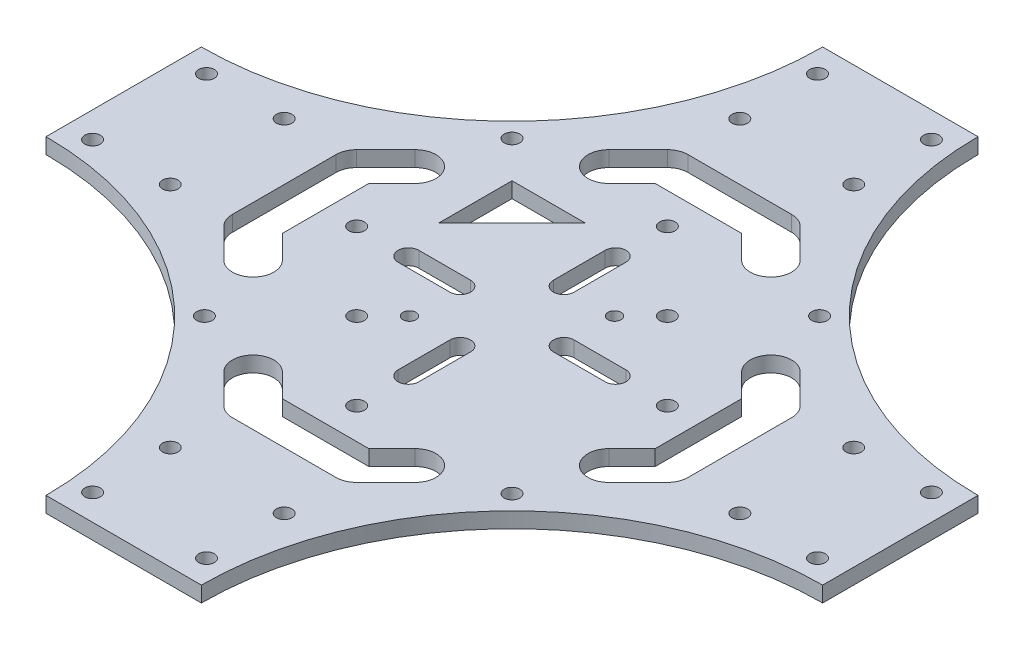
from build123d import *

# Parameters (mm, degrees)
SKETCH_1_R               = 1.25
EXTRUDE_1_DEPTH          = 3
SKETCH_2_R               = 1.5
CUT_EXTRUDE_1_DEPTH      = 3
CUT_EXTRUDE_2_DEPTH      = 3
CUT_EXTRUDE_3_DEPTH      = 3
CUT_EXTRUDE_4_DEPTH      = 10
SKETCH_6_R               = 1.5
CUT_EXTRUDE_5_DEPTH      = 10
SKETCH_7_R               = 1.5
CUT_EXTRUDE_8_DEPTH      = 10
SKETCH_8_R               = 1.5
CUT_EXTRUDE_9_DEPTH      = 10
SKETCH_9_R               = 15
CUT_EXTRUDE_10_DEPTH     = 10
SKETCH_11_R              = 1.5
EXTRUDE_3_DEPTH          = 3
CUT_EXTRUDE_12_DEPTH     = 3
EXTRUDE_4_DEPTH          = 3
SKETCH_15_R              = 15
EXTRUDE_5_DEPTH          = 3
CUT_EXTRUDE_13_DEPTH     = 3
EXTRUDE_START            = -3
EXTRUDE_7_DEPTH          = 3
CUT_EXTRUDE_14_DEPTH     = 3
CUT_EXTRUDE_15_DEPTH     = 3
PATTERN_CIRCULAR_1_COUNT = 8
SKETCH_22_R              = 1.25
CUT_EXTRUDE_17_DEPTH     = 3
SKETCH_23_R              = 1.5
CUT_EXTRUDE_18_DEPTH     = 10
SKETCH_24_R              = 1.5
CUT_EXTRUDE_19_DEPTH     = 10
CUT_EXTRUDE_START        = -10
SKETCH_25_R              = 60
CUT_EXTRUDE_20_DEPTH     = 10
EXTRUDE_8_DEPTH          = 3
EXTRUDE_10_DEPTH         = 3
SKETCH_28_R              = 1.54
SKETCH_28_R_2            = 1.52
SKETCH_28_R_3            = 1.5
CUT_EXTRUDE_21_DEPTH     = 3
SKETCH_29_R              = 1.5
CUT_EXTRUDE_22_DEPTH     = 3
EXTRUDE_11_DEPTH         = 3
SKETCH_31_R              = 1.5
CUT_EXTRUDE_23_DEPTH     = 3
EXTRUDE_12_DEPTH         = 3
CUT_EXTRUDE_24_DEPTH     = 3
EXTRUDE_13_DEPTH         = 3
CUT_EXTRUDE_25_DEPTH     = 10
CUT_EXTRUDE_26_DEPTH     = 10
EXTRUDE_14_DEPTH         = 3
SKETCH_38_R              = 6
CUT_EXTRUDE_28_DEPTH     = 3
SKETCH_39_R              = 1.5
CUT_EXTRUDE_29_DEPTH     = 3
SKETCH_40_R              = 60
CUT_EXTRUDE_30_DEPTH     = 10


with BuildPart() as part:
    # 草图1 → 凸台-拉伸1 (new body)
    with BuildSketch(Plane(origin=(0, 0, 0), x_dir=(1, 0, 0), z_dir=(0, 1, 0))):
        with BuildLine():
            Line((-75, 15), (-75, -15))
            ThreePointArc((-75, -15), (-32.573593129, -32.573593129), (-15, -75))
            Line((-15, -75), (15, -75))
            ThreePointArc((15, -75), (32.573593129, -32.573593129), (75, -15))
            Line((75, -15), (75, 15))
            ThreePointArc((75, 15), (32.573593129, 32.573593129), (15, 75))
            Line((15, 75), (-15, 75))
            ThreePointArc((-15, 75), (-32.573593129, 32.573593129), (-75, 15))
        make_face()
        with Locations((-70, 11)):
            Circle(SKETCH_1_R, mode=Mode.SUBTRACT)
        with Locations((-11, 70)):
            Circle(SKETCH_1_R, mode=Mode.SUBTRACT)
        with Locations((-70, -11)):
            Circle(SKETCH_1_R, mode=Mode.SUBTRACT)
        with Locations((-11, -70)):
            Circle(SKETCH_1_R, mode=Mode.SUBTRACT)
        with Locations((11, 70)):
            Circle(SKETCH_1_R, mode=Mode.SUBTRACT)
        with Locations((70, 11)):
            Circle(SKETCH_1_R, mode=Mode.SUBTRACT)
        with Locations((70, -11)):
            Circle(SKETCH_1_R, mode=Mode.SUBTRACT)
        with Locations((11, -70)):
            Circle(SKETCH_1_R, mode=Mode.SUBTRACT)
    extrude(amount=EXTRUDE_1_DEPTH)

    # 草图2 → 切除-拉伸1 (cut)
    with BuildSketch(Plane.XZ):
        with Locations((0.353553391, -31.466251763)):
            Circle(SKETCH_2_R)
        with Locations((31.466251763, -0.353553391)):
            Circle(SKETCH_2_R)
        with Locations((-0.353553391, 31.466251763)):
            Circle(SKETCH_2_R)
        with Locations((-31.466251763, 0.353553391)):
            Circle(SKETCH_2_R)
    extrude(amount=-CUT_EXTRUDE_1_DEPTH, mode=Mode.SUBTRACT)

    # 草图3 → 切除-拉伸2 (cut)
    with BuildSketch(Plane(origin=(0, 3, 0), x_dir=(1, 0, 0), z_dir=(0, 1, 0))):
        Polygon((-12.02081528, 19.091883092), (-22.627416998, 22.627416998), (-19.091883092, 12.02081528), align=None)
    extrude(amount=-CUT_EXTRUDE_2_DEPTH, mode=Mode.SUBTRACT)

    # 草图4 → 切除-拉伸3 (cut)
    with BuildSketch(Plane(origin=(0, 3, 0), x_dir=(1, 0, 0), z_dir=(0, 1, 0))):
        with BuildLine():
            ThreePointArc((33.944668714, -19.80253309), (34.043922781, -8.582763971), (22.827665534, -8.285032838))
            Line((22.827665534, -8.285032838), (15.556349186, -15.556349186))
            Line((15.556349186, -15.556349186), (8.285032838, -22.827665534))
            ThreePointArc((8.285032838, -22.827665534), (8.582763971, -34.043922781), (19.80253309, -33.944668714))
            Line((19.80253309, -33.944668714), (33.944668714, -19.80253309))
        make_face()
    extrude(amount=-CUT_EXTRUDE_3_DEPTH, mode=Mode.SUBTRACT)

    # 草图5 → 切除-拉伸4 (cut)
    with BuildSketch(Plane(origin=(0, 3, 0), x_dir=(1, 0, 0), z_dir=(0, 1, 0))):
        Polygon((-22.627416998, 22.627416998), (-12.02081528, 19.091883092), (-8.485281374, 22.627416998), align=None)
        Polygon((-19.091883092, 12.02081528), (-22.627416998, 22.627416998), (-22.627416998, 8.485281374), align=None)
    extrude(amount=-CUT_EXTRUDE_4_DEPTH, mode=Mode.SUBTRACT)

    # 草图6 → 切除-拉伸5 (cut)
    with BuildSketch(Plane(origin=(0, 3, 0), x_dir=(1, 0, 0), z_dir=(0, 1, 0))):
        with Locations((-35.355339059, -21.213203436)):
            Circle(SKETCH_6_R)
        with Locations((-21.213203436, -35.355339059)):
            Circle(SKETCH_6_R)
        with Locations((35.355339059, 21.213203436)):
            Circle(SKETCH_6_R)
        with Locations((21.213203436, 35.355339059)):
            Circle(SKETCH_6_R)
    extrude(amount=-CUT_EXTRUDE_5_DEPTH, mode=Mode.SUBTRACT)

    # 草图7 → 切除-拉伸8 (cut)
    with BuildSketch(Plane(origin=(0, 3, 0), x_dir=(1, 0, 0), z_dir=(0, 1, 0))):
        with Locations((-29.69848481, 29.69848481)):
            Circle(SKETCH_7_R)
        with Locations((29.69848481, 29.69848481)):
            Circle(SKETCH_7_R)
        with Locations((29.69848481, -29.69848481)):
            Circle(SKETCH_7_R)
        with Locations((-29.69848481, -29.69848481)):
            Circle(SKETCH_7_R)
    extrude(amount=-CUT_EXTRUDE_8_DEPTH, mode=Mode.SUBTRACT)

    # 草图8 → 切除-拉伸9 (cut)
    with BuildSketch(Plane(origin=(0, 3, 0), x_dir=(1, 0, 0), z_dir=(0, 1, 0))):
        with Locations((-11, 55)):
            Circle(SKETCH_8_R)
        with Locations((11, 55)):
            Circle(SKETCH_8_R)
        with Locations((55, 11)):
            Circle(SKETCH_8_R)
        with Locations((55, -11)):
            Circle(SKETCH_8_R)
        with Locations((11, -55)):
            Circle(SKETCH_8_R)
        with Locations((-11, -55)):
            Circle(SKETCH_8_R)
        with Locations((-55, -11)):
            Circle(SKETCH_8_R)
        with Locations((-55, 11)):
            Circle(SKETCH_8_R)
    extrude(amount=-CUT_EXTRUDE_9_DEPTH, mode=Mode.SUBTRACT)

    # 草图9 → 切除-拉伸10 (cut)
    with BuildSketch(Plane(origin=(0, 3, 0), x_dir=(1, 0, 0), z_dir=(0, 1, 0))):
        Circle(SKETCH_9_R)
    extrude(amount=-CUT_EXTRUDE_10_DEPTH, mode=Mode.SUBTRACT)

    # 草图11 → 凸台-拉伸3 (add)
    with BuildSketch(Plane(origin=(0, 3, 0), x_dir=(1, 0, 0), z_dir=(0, 1, 0))):
        with Locations((-35.355339059, -21.213203436)):
            Circle(SKETCH_11_R)
        with Locations((35.355339059, 21.213203436)):
            Circle(SKETCH_11_R)
        with Locations((21.213203436, 35.355339059)):
            Circle(SKETCH_11_R)
        with Locations((0.353553391, 31.466251763)):
            Circle(SKETCH_11_R)
        with Locations((31.466251763, 0.353553391)):
            Circle(SKETCH_11_R)
        with Locations((-0.353553391, -31.466251763)):
            Circle(SKETCH_11_R)
        with Locations((-31.466251763, -0.353553391)):
            Circle(SKETCH_11_R)
        with Locations((-21.213203436, -35.355339059)):
            Circle(SKETCH_11_R)
    extrude(amount=-EXTRUDE_3_DEPTH)

    # 草图12 → 切除-拉伸12 (cut)
    with BuildSketch(Plane(origin=(0, 3, 0), x_dir=(1, 0, 0), z_dir=(0, 1, 0))):
        with BuildLine():
            Line((-44, 10), (-44, -10))
            ThreePointArc((-44, -10), (-40, -14), (-36, -10))
            Line((-36, -10), (-36, 0))
            Line((-36, 0), (-36, 10))
            ThreePointArc((-36, 10), (-40, 14), (-44, 10))
        make_face()
        with BuildLine():
            Line((10, 44), (-10, 44))
            ThreePointArc((-10, 44), (-14, 40), (-10, 36))
            Line((-10, 36), (10, 36))
            ThreePointArc((10, 36), (14, 40), (10, 44))
        make_face()
        with BuildLine():
            Line((44, -10), (44, 10))
            ThreePointArc((44, 10), (40, 14), (36, 10))
            Line((36, 10), (36, -10))
            ThreePointArc((36, -10), (40, -14), (44, -10))
        make_face()
        with BuildLine():
            Line((-10, -44), (10, -44))
            ThreePointArc((10, -44), (14, -40), (10, -36))
            Line((10, -36), (-10, -36))
            ThreePointArc((-10, -36), (-14, -40), (-10, -44))
        make_face()
    extrude(amount=-CUT_EXTRUDE_12_DEPTH, mode=Mode.SUBTRACT)

    # 草图14 → 凸台-拉伸4 (add)
    with BuildSketch(Plane(origin=(0, 3, 0), x_dir=(1, 0, 0), z_dir=(0, 1, 0))):
        with BuildLine():
            ThreePointArc((8.285032838, -22.827665534), (8.582763971, -34.043922781), (19.80253309, -33.944668714))
            Line((19.80253309, -33.944668714), (33.944668714, -19.80253309))
            ThreePointArc((33.944668714, -19.80253309), (34.043922781, -8.582763971), (22.827665534, -8.285032838))
            Line((22.827665534, -8.285032838), (8.285032838, -22.827665534))
        make_face()
    extrude(amount=-EXTRUDE_4_DEPTH)

    # 草图15 → 凸台-拉伸5 (add)
    with BuildSketch(Plane(origin=(0, 3, 0), x_dir=(1, 0, 0), z_dir=(0, 1, 0))):
        Circle(SKETCH_15_R)
    extrude(amount=-EXTRUDE_5_DEPTH)

    # 草图17 → 切除-拉伸13 (cut)
    with BuildSketch(Plane(origin=(0, 3, 0), x_dir=(1, 0, 0), z_dir=(0, 1, 0))):
        with BuildLine():
            Line((-2, -20), (-2, -10))
            ThreePointArc((-2, -10), (0, -8), (2, -10))
            Line((2, -10), (2, -20))
            ThreePointArc((2, -20), (0, -22), (-2, -20))
        make_face()
        with BuildLine():
            Line((-20, 2), (-10, 2))
            ThreePointArc((-10, 2), (-8, 0), (-10, -2))
            Line((-10, -2), (-20, -2))
            ThreePointArc((-20, -2), (-22, 0), (-20, 2))
        make_face()
        with BuildLine():
            Line((2, 20), (2, 10))
            ThreePointArc((2, 10), (0, 8), (-2, 10))
            Line((-2, 10), (-2, 20))
            ThreePointArc((-2, 20), (0, 22), (2, 20))
        make_face()
        with BuildLine():
            Line((20, -2), (10, -2))
            ThreePointArc((10, -2), (8, 0), (10, 2))
            Line((10, 2), (20, 2))
            ThreePointArc((20, 2), (22, 0), (20, -2))
        make_face()
    extrude(amount=-CUT_EXTRUDE_13_DEPTH, mode=Mode.SUBTRACT)

    # 草图18 → 凸台-拉伸7 (add)
    with BuildSketch(Plane(origin=(0, 3, 0), x_dir=(1, 0, 0), z_dir=(0, 1, 0)).offset(EXTRUDE_START)):
        with BuildLine():
            ThreePointArc((-45.952273324, 22.500194525), (-32.573593129, 32.573593129), (-22.500194525, 45.952273324))
            Line((-22.500194525, 45.952273324), (-38.525223259, 61.977302058))
            ThreePointArc((-38.525223259, 61.977302058), (-89.142135624, 89.142135624), (-61.977302058, 38.525223259))
            Line((-61.977302058, 38.525223259), (-45.952273324, 22.500194525))
        make_face()
    extrude(amount=EXTRUDE_7_DEPTH)

    # 草图19 → 切除-拉伸14 (cut)
    with BuildSketch(Plane(origin=(0, 3, 0), x_dir=(1, 0, 0), z_dir=(0, 1, 0))):
        with BuildLine():
            ThreePointArc((-37.140781925, 51.282917549), (-43.180194847, 43.180194847), (-51.282917549, 37.140781925))
            Line((-51.282917549, 37.140781925), (-43.975815885, 29.833680261))
            ThreePointArc((-43.975815885, 29.833680261), (-36.109127035, 36.109127035), (-29.833680261, 43.975815885))
            Line((-29.833680261, 43.975815885), (-37.140781925, 51.282917549))
        make_face()
    extrude(amount=-CUT_EXTRUDE_14_DEPTH, mode=Mode.SUBTRACT)

    # 草图21 → 切除-拉伸15 (cut)
    with BuildSketch(Plane(origin=(0, 3, 0), x_dir=(1, 0, 0), z_dir=(0, 1, 0))):
        with BuildLine():
            ThreePointArc((-59.9739809, 61.741747853), (-60.857864376, 62.107864376), (-61.741747853, 61.741747853))
            ThreePointArc((-61.741747853, 61.741747853), (-62.107864376, 60.857864376), (-61.741747853, 59.9739809))
            Line((-61.741747853, 59.9739809), (-54.670680041, 52.902913088))
            ThreePointArc((-54.670680041, 52.902913088), (-52.902913088, 52.902913088), (-52.902913088, 54.670680041))
            Line((-52.902913088, 54.670680041), (-59.9739809, 61.741747853))
        make_face()
        with BuildLine():
            ThreePointArc((-75.883883476, 74.116116524), (-75, 73.75), (-74.116116524, 74.116116524))
            ThreePointArc((-74.116116524, 74.116116524), (-73.75, 75), (-74.116116524, 75.883883476))
            Line((-74.116116524, 75.883883476), (-81.187184335, 82.954951288))
            ThreePointArc((-81.187184335, 82.954951288), (-82.954951288, 82.954951288), (-82.954951288, 81.187184335))
            Line((-82.954951288, 81.187184335), (-75.883883476, 74.116116524))
        make_face()
    cut_extrude_15 = extrude(amount=-CUT_EXTRUDE_15_DEPTH, mode=Mode.SUBTRACT)

    # 阵列(圆周)1: 切除-拉伸15 ×8 about axis
    pattern_circular_1_axis = Axis((-67.928932188, 3, -67.928932188), (0, 1, 0))
    for i in range(1, PATTERN_CIRCULAR_1_COUNT):
        add(cut_extrude_15.rotate(pattern_circular_1_axis, i * 360 / PATTERN_CIRCULAR_1_COUNT), mode=Mode.SUBTRACT)

    # 草图22 → 切除-拉伸17 (cut)
    with BuildSketch(Plane(origin=(0, 3, 0), x_dir=(1, 0, 0), z_dir=(0, 1, 0))):
        with Locations((9.899494937, 9.899494937)):
            Circle(SKETCH_22_R)
        with Locations((-9.899494937, -9.899494937)):
            Circle(SKETCH_22_R)
    extrude(amount=-CUT_EXTRUDE_17_DEPTH, mode=Mode.SUBTRACT)

    # 草图23 → 切除-拉伸18 (cut)
    with BuildSketch(Plane(origin=(0, 3, 0), x_dir=(1, 0, 0), z_dir=(0, 1, 0))):
        with Locations((0, 30)):
            Circle(SKETCH_23_R)
        with Locations((30, 0)):
            Circle(SKETCH_23_R)
        with Locations((0, -30)):
            Circle(SKETCH_23_R)
        with Locations((-30, 0)):
            Circle(SKETCH_23_R)
    extrude(amount=-CUT_EXTRUDE_18_DEPTH, mode=Mode.SUBTRACT)

    # 草图24 → 切除-拉伸19 (cut)
    with BuildSketch(Plane(origin=(0, 3, 0), x_dir=(1, 0, 0), z_dir=(0, 1, 0))):
        with Locations((-15, -15)):
            Circle(SKETCH_24_R)
        with Locations((15, 15)):
            Circle(SKETCH_24_R)
    extrude(amount=-CUT_EXTRUDE_19_DEPTH, mode=Mode.SUBTRACT)

    # 草图25 → 切除-拉伸20 (cut)
    with BuildSketch(Plane(origin=(0, 3, 0), x_dir=(1, 0, 0), z_dir=(0, 1, 0)).offset(CUT_EXTRUDE_START)):
        with Locations((-75, 75)):
            Circle(SKETCH_25_R)
    extrude(amount=CUT_EXTRUDE_20_DEPTH, mode=Mode.SUBTRACT)

    # 草图26 → 凸台-拉伸8 (add)
    with BuildSketch(Plane(origin=(0, 3, 0), x_dir=(1, 0, 0), z_dir=(0, 1, 0)).offset(EXTRUDE_START)):
        with BuildLine():
            ThreePointArc((-75, 15), (-32.573593129, 32.573593129), (-15, 75))
            Line((-15, 75), (-75, 15))
        make_face()
    extrude(amount=EXTRUDE_8_DEPTH)

    # 草图27 → 凸台-拉伸10 (add)
    with BuildSketch(Plane.XZ):
        Polygon((-75, -15), (-89.142135624, -29.142135624), (-29.142135624, -89.142135624), (-15, -75), align=None)
    extrude(amount=-EXTRUDE_10_DEPTH)

    # 草图28 → 切除-拉伸21 (cut)
    with BuildSketch(Plane.XZ):
        with Locations((-25.908116908, -78.234018716)):
            Circle(SKETCH_28_R)
        with Locations((-78.234018716, -25.908116908)):
            Circle(SKETCH_28_R_2)
        with Locations((11, -70)):
            Circle(SKETCH_28_R_3)
        with Locations((-11, -70)):
            Circle(SKETCH_28_R_3)
        with Locations((-70, -11)):
            Circle(SKETCH_28_R_3)
        with Locations((-70, 11)):
            Circle(SKETCH_28_R_3)
        with Locations((-11, 70)):
            Circle(SKETCH_28_R_3)
        with Locations((11, 70)):
            Circle(SKETCH_28_R_3)
        with Locations((70, 11)):
            Circle(SKETCH_28_R_3)
        with Locations((70, -11)):
            Circle(SKETCH_28_R_3)
    extrude(amount=-CUT_EXTRUDE_21_DEPTH, mode=Mode.SUBTRACT)

    # 草图29 → 切除-拉伸22 (cut)
    with BuildSketch(Plane.XZ):
        with Locations((-68.334523779, -35.807611845)):
            Circle(SKETCH_29_R)
        with Locations((-35.807611845, -68.334523779)):
            Circle(SKETCH_29_R)
    extrude(amount=-CUT_EXTRUDE_22_DEPTH, mode=Mode.SUBTRACT)

    # 草图30 → 凸台-拉伸11 (add)
    with BuildSketch(Plane.XZ):
        Polygon((-29.142135624, -89.142135624), (-89.142135624, -29.142135624), (-103.284271247, -43.284271247), (-43.284271247, -103.284271247), align=None)
    extrude(amount=-EXTRUDE_11_DEPTH)

    # 草图31 → 切除-拉伸23 (cut)
    with BuildSketch(Plane.XZ):
        with Locations((-43.585786438, -95.911688245)):
            Circle(SKETCH_31_R)
        with Locations((-53.485281374, -86.012193309)):
            Circle(SKETCH_31_R)
        with Locations((-86.012193309, -53.485281374)):
            Circle(SKETCH_31_R)
        with Locations((-95.911688245, -43.585786438)):
            Circle(SKETCH_31_R)
    extrude(amount=-CUT_EXTRUDE_23_DEPTH, mode=Mode.SUBTRACT)

    # 草图32 → 凸台-拉伸12 (add)
    with BuildSketch(Plane.XZ):
        with BuildLine():
            ThreePointArc((15, 75), (32.573593129, 32.573593129), (75, 15))
            Line((75, 15), (89.142135624, 29.142135624))
            Line((89.142135624, 29.142135624), (29.142135624, 89.142135624))
            Line((29.142135624, 89.142135624), (15, 75))
        make_face()
    extrude(amount=-EXTRUDE_12_DEPTH)

    # 草图33 → 切除-拉伸24 (cut)
    with BuildSketch(Plane(origin=(0, 0, 0), x_dir=(-1, 0, 0), z_dir=(0, -1, 0))):
        with BuildLine():
            Line((-29.554853575, -42.91995823), (-19.554853575, -42.91995823))
            ThreePointArc((-19.554853575, -42.91995823), (-18.054501588, -44.420310217), (-19.554853575, -45.920662203))
            Line((-19.554853575, -45.920662203), (-29.554853575, -45.920662203))
            ThreePointArc((-29.554853575, -45.920662203), (-31.055205561, -44.420310217), (-29.554853575, -42.91995823))
        make_face()
        with BuildLine():
            Line((-42.91995823, -59.285766859), (-42.91995823, -69.285766859))
            ThreePointArc((-42.91995823, -69.285766859), (-44.420310217, -70.786118845), (-45.920662203, -69.285766859))
            Line((-45.920662203, -69.285766859), (-45.920662203, -59.285766859))
            ThreePointArc((-45.920662203, -59.285766859), (-44.420310217, -57.785414872), (-42.91995823, -59.285766859))
        make_face()
        with BuildLine():
            Line((-59.285766859, -45.920662203), (-69.285766859, -45.920662203))
            ThreePointArc((-69.285766859, -45.920662203), (-70.786118845, -44.420310217), (-69.285766859, -42.91995823))
            Line((-69.285766859, -42.91995823), (-59.285766859, -42.91995823))
            ThreePointArc((-59.285766859, -42.91995823), (-57.785414872, -44.420310217), (-59.285766859, -45.920662203))
        make_face()
        with BuildLine():
            Line((-45.920662203, -29.554853575), (-45.920662203, -19.554853575))
            ThreePointArc((-45.920662203, -19.554853575), (-44.420310217, -18.054501588), (-42.91995823, -19.554853575))
            Line((-42.91995823, -19.554853575), (-42.91995823, -29.554853575))
            ThreePointArc((-42.91995823, -29.554853575), (-44.420310217, -31.055205561), (-45.920662203, -29.554853575))
        make_face()
    extrude(amount=-CUT_EXTRUDE_24_DEPTH, mode=Mode.SUBTRACT)

    # 草图34 → 凸台-拉伸13 (add)
    with BuildSketch(Plane.XZ):
        Polygon((29.142135624, 89.142135624), (89.142135624, 29.142135624), (103.284271247, 43.284271247), (43.284271247, 103.284271247), align=None)
    extrude(amount=-EXTRUDE_13_DEPTH)

    # 草图35 → 切除-拉伸25 (cut)
    with BuildSketch(Plane.XZ.offset(CUT_EXTRUDE_START)):
        with BuildLine():
            Line((18.485281374, 37.171572875), (12.828427125, 42.828427125))
            ThreePointArc((12.828427125, 42.828427125), (7.171572875, 42.828427125), (7.171572875, 37.171572875))
            Line((7.171572875, 37.171572875), (12.828427125, 31.514718626))
            ThreePointArc((12.828427125, 31.514718626), (18.485281374, 31.514718626), (18.485281374, 37.171572875))
        make_face()
        with BuildLine():
            Line((-12.828427125, 31.514718626), (-7.171572875, 37.171572875))
            ThreePointArc((-7.171572875, 37.171572875), (-7.171572875, 42.828427125), (-12.828427125, 42.828427125))
            Line((-12.828427125, 42.828427125), (-18.485281374, 37.171572875))
            ThreePointArc((-18.485281374, 37.171572875), (-18.485281374, 31.514718626), (-12.828427125, 31.514718626))
        make_face()
        with BuildLine():
            Line((37.171572875, -18.485281374), (42.828427125, -12.828427125))
            ThreePointArc((42.828427125, -12.828427125), (42.828427125, -7.171572875), (37.171572875, -7.171572875))
            Line((37.171572875, -7.171572875), (31.514718626, -12.828427125))
            ThreePointArc((31.514718626, -12.828427125), (31.514718626, -18.485281374), (37.171572875, -18.485281374))
        make_face()
        with BuildLine():
            Line((31.514718626, 12.828427125), (37.171572875, 7.171572875))
            ThreePointArc((37.171572875, 7.171572875), (42.828427125, 7.171572875), (42.828427125, 12.828427125))
            Line((42.828427125, 12.828427125), (37.171572875, 18.485281374))
            ThreePointArc((37.171572875, 18.485281374), (31.514718626, 18.485281374), (31.514718626, 12.828427125))
        make_face()
        with BuildLine():
            Line((-18.485281374, -37.171572875), (-12.828427125, -42.828427125))
            ThreePointArc((-12.828427125, -42.828427125), (-7.171572875, -42.828427125), (-7.171572875, -37.171572875))
            Line((-7.171572875, -37.171572875), (-12.828427125, -31.514718626))
            ThreePointArc((-12.828427125, -31.514718626), (-18.485281374, -31.514718626), (-18.485281374, -37.171572875))
        make_face()
        with BuildLine():
            Line((12.828427125, -31.514718626), (7.171572875, -37.171572875))
            ThreePointArc((7.171572875, -37.171572875), (7.171572875, -42.828427125), (12.828427125, -42.828427125))
            Line((12.828427125, -42.828427125), (18.485281374, -37.171572875))
            ThreePointArc((18.485281374, -37.171572875), (18.485281374, -31.514718626), (12.828427125, -31.514718626))
        make_face()
        with BuildLine():
            Line((-37.171572875, 18.485281374), (-42.828427125, 12.828427125))
            ThreePointArc((-42.828427125, 12.828427125), (-42.828427125, 7.171572875), (-37.171572875, 7.171572875))
            Line((-37.171572875, 7.171572875), (-31.514718626, 12.828427125))
            ThreePointArc((-31.514718626, 12.828427125), (-31.514718626, 18.485281374), (-37.171572875, 18.485281374))
        make_face()
        with BuildLine():
            Line((-31.514718626, -12.828427125), (-37.171572875, -7.171572875))
            ThreePointArc((-37.171572875, -7.171572875), (-42.828427125, -7.171572875), (-42.828427125, -12.828427125))
            Line((-42.828427125, -12.828427125), (-37.171572875, -18.485281374))
            ThreePointArc((-37.171572875, -18.485281374), (-31.514718626, -18.485281374), (-31.514718626, -12.828427125))
        make_face()
    extrude(amount=CUT_EXTRUDE_25_DEPTH, mode=Mode.SUBTRACT)

    # 草图36 → 切除-拉伸26 (cut)
    with BuildSketch(Plane.XZ):
        with BuildLine():
            Line((19.554853575, 45.920310217), (29.554853575, 45.920310217))
            ThreePointArc((29.554853575, 45.920310217), (31.054853575, 44.420310217), (29.554853575, 42.920310217))
            Line((29.554853575, 42.920310217), (19.554853575, 42.920310217))
            ThreePointArc((19.554853575, 42.920310217), (18.054853575, 44.420310217), (19.554853575, 45.920310217))
        make_face()
        with BuildLine():
            Line((45.920310217, 69.285766859), (45.920310217, 59.285766859))
            ThreePointArc((45.920310217, 59.285766859), (44.420310217, 57.785766859), (42.920310217, 59.285766859))
            Line((42.920310217, 59.285766859), (42.920310217, 69.285766859))
            ThreePointArc((42.920310217, 69.285766859), (44.420310217, 70.785766859), (45.920310217, 69.285766859))
        make_face()
        with BuildLine():
            Line((69.285766859, 42.920310217), (59.285766859, 42.920310217))
            ThreePointArc((59.285766859, 42.920310217), (57.785766859, 44.420310217), (59.285766859, 45.920310217))
            Line((59.285766859, 45.920310217), (69.285766859, 45.920310217))
            ThreePointArc((69.285766859, 45.920310217), (70.785766859, 44.420310217), (69.285766859, 42.920310217))
        make_face()
        with BuildLine():
            Line((42.920310217, 19.554853575), (42.920310217, 29.554853575))
            ThreePointArc((42.920310217, 29.554853575), (44.420310217, 31.054853575), (45.920310217, 29.554853575))
            Line((45.920310217, 29.554853575), (45.920310217, 19.554853575))
            ThreePointArc((45.920310217, 19.554853575), (44.420310217, 18.054853575), (42.920310217, 19.554853575))
        make_face()
        with BuildLine():
            Line((26.625921387, 52.991378029), (36.625921387, 52.991378029))
            ThreePointArc((36.625921387, 52.991378029), (38.125921387, 51.491378029), (36.625921387, 49.991378029))
            Line((36.625921387, 49.991378029), (26.625921387, 49.991378029))
            ThreePointArc((26.625921387, 49.991378029), (25.125921387, 51.491378029), (26.625921387, 52.991378029))
        make_face()
        with BuildLine():
            Line((52.991378029, 76.356834671), (52.991378029, 66.356834671))
            ThreePointArc((52.991378029, 66.356834671), (51.491378029, 64.856834671), (49.991378029, 66.356834671))
            Line((49.991378029, 66.356834671), (49.991378029, 76.356834671))
            ThreePointArc((49.991378029, 76.356834671), (51.491378029, 77.856834671), (52.991378029, 76.356834671))
        make_face()
        with BuildLine():
            Line((76.356834671, 49.991378029), (66.356834671, 49.991378029))
            ThreePointArc((66.356834671, 49.991378029), (64.856834671, 51.491378029), (66.356834671, 52.991378029))
            Line((66.356834671, 52.991378029), (76.356834671, 52.991378029))
            ThreePointArc((76.356834671, 52.991378029), (77.856834671, 51.491378029), (76.356834671, 49.991378029))
        make_face()
        with BuildLine():
            Line((49.991378029, 26.625921387), (49.991378029, 36.625921387))
            ThreePointArc((49.991378029, 36.625921387), (51.491378029, 38.125921387), (52.991378029, 36.625921387))
            Line((52.991378029, 36.625921387), (52.991378029, 26.625921387))
            ThreePointArc((52.991378029, 26.625921387), (51.491378029, 25.125921387), (49.991378029, 26.625921387))
        make_face()
    extrude(amount=-CUT_EXTRUDE_26_DEPTH, mode=Mode.SUBTRACT)

    # 草图37 → 凸台-拉伸14 (add)
    with BuildSketch(Plane.XZ):
        with BuildLine():
            Line((47.887960234, 69.285766859), (47.887960234, 59.853486281))
            ThreePointArc((47.887960234, 59.853486281), (44.420310217, 56.385836264), (40.9526602, 59.853486281))
            Line((40.9526602, 59.853486281), (40.9526602, 69.285766859))
            ThreePointArc((40.9526602, 69.285766859), (44.420310217, 72.753416876), (47.887960234, 69.285766859))
        make_face()
        with BuildLine():
            Line((60.034978693, 48.181382834), (68.503147508, 48.181382834))
            ThreePointArc((68.503147508, 48.181382834), (71.914895036, 44.769635306), (68.503147508, 41.357887778))
            Line((68.503147508, 41.357887778), (60.034978693, 41.357887778))
            ThreePointArc((60.034978693, 41.357887778), (56.623231165, 44.769635306), (60.034978693, 48.181382834))
        make_face()
        with BuildLine():
            Line((48.512210879, 29.554853575), (48.512210879, 19.628947818))
            ThreePointArc((48.512210879, 19.628947818), (44.420310217, 15.537047156), (40.328409554, 19.628947818))
            Line((40.328409554, 19.628947818), (40.328409554, 29.554853575))
            ThreePointArc((40.328409554, 29.554853575), (44.420310217, 33.646754237), (48.512210879, 29.554853575))
        make_face()
        with BuildLine():
            Line((20.324066568, 48.08525583), (29.519488245, 48.08525583))
            ThreePointArc((29.519488245, 48.08525583), (32.835108769, 44.769635306), (29.519488245, 41.454014782))
            Line((29.519488245, 41.454014782), (20.324066568, 41.454014782))
            ThreePointArc((20.324066568, 41.454014782), (17.008446044, 44.769635306), (20.324066568, 48.08525583))
        make_face()
    extrude(amount=-EXTRUDE_14_DEPTH)

    # 草图38 → 切除-拉伸28 (cut)
    with BuildSketch(Plane.XZ):
        with Locations((51.491378029, 51.491378029)):
            Circle(SKETCH_38_R)
        with Locations((-58.110173055, -58.110173055)):
            Circle(SKETCH_38_R)
        Polygon((-52.453318806, -52.453318806), (-53.867532368, -51.039105243), (-51.039105243, -51.039105243), (-51.039105243, -53.867532368), align=None)
        Polygon((57.148232278, 57.148232278), (55.734018716, 58.562445841), (58.562445841, 58.562445841), (58.562445841, 55.734018716), align=None)
        Polygon((59.491378029, 53.491378029), (61.491378029, 51.491378029), (59.491378029, 49.491378029), (59.491378029, 51.491378029), align=None)
        Polygon((58.562445841, 47.248737342), (58.562445841, 44.420310217), (55.734018716, 44.420310217), (57.148232278, 45.834523779), align=None)
        Polygon((53.491378029, 43.491378029), (51.491378029, 41.491378029), (49.491378029, 43.491378029), (51.491378029, 43.491378029), align=None)
        Polygon((47.248737342, 44.420310217), (44.420310217, 44.420310217), (44.420310217, 47.248737342), (45.834523779, 45.834523779), align=None)
        Polygon((43.491378029, 49.491378029), (41.491378029, 51.491378029), (43.491378029, 53.491378029), (43.491378029, 51.491378029), align=None)
        Polygon((44.420310217, 55.734018716), (44.420310217, 58.562445841), (47.248737342, 58.562445841), (45.834523779, 57.148232278), align=None)
        Polygon((49.491378029, 59.491378029), (51.491378029, 61.491378029), (53.491378029, 59.491378029), (51.491378029, 59.491378029), align=None)
        Polygon((-50.110173055, -56.110173055), (-48.110173055, -58.110173055), (-50.110173055, -60.110173055), (-50.110173055, -58.110173055), align=None)
        Polygon((-51.039105243, -62.352813742), (-51.039105243, -65.181240867), (-53.867532368, -65.181240867), (-52.453318806, -63.767027305), align=None)
        Polygon((-56.110173055, -66.110173055), (-58.110173055, -68.110173055), (-60.110173055, -66.110173055), (-58.110173055, -66.110173055), align=None)
        Polygon((-62.352813742, -65.181240867), (-65.181240867, -65.181240867), (-65.181240867, -62.352813742), (-63.767027305, -63.767027305), align=None)
        Polygon((-66.110173055, -60.110173055), (-68.110173055, -58.110173055), (-66.110173055, -56.110173055), (-66.110173055, -58.110173055), align=None)
        Polygon((-65.181240867, -53.867532368), (-65.181240867, -51.039105243), (-62.352813742, -51.039105243), (-63.767027305, -52.453318806), align=None)
        Polygon((-60.110173055, -50.110173055), (-58.110173055, -48.110173055), (-56.110173055, -50.110173055), (-58.110173055, -50.110173055), align=None)
    extrude(amount=-CUT_EXTRUDE_28_DEPTH, mode=Mode.SUBTRACT)

    # 草图39 → 切除-拉伸29 (cut)
    with BuildSketch(Plane.XZ):
        with Locations((-69.748737342, -69.748737342)):
            Circle(SKETCH_39_R)
        with Locations((-73.991378029, -65.506096654)):
            Circle(SKETCH_39_R)
        with Locations((-78.234018716, -61.263455967)):
            Circle(SKETCH_39_R)
        with Locations((-82.476659403, -57.02081528)):
            Circle(SKETCH_39_R)
        with Locations((-65.506096654, -73.991378029)):
            Circle(SKETCH_39_R)
        with Locations((-61.263455967, -78.234018716)):
            Circle(SKETCH_39_R)
        with Locations((-57.02081528, -82.476659403)):
            Circle(SKETCH_39_R)
    extrude(amount=-CUT_EXTRUDE_29_DEPTH, mode=Mode.SUBTRACT)

    # 草图40 → 切除-拉伸30 (cut)
    with BuildSketch(Plane.XZ):
        with Locations((75, -75)):
            Circle(SKETCH_40_R)
        with Locations((-75, -75)):
            Circle(SKETCH_40_R)
        with Locations((-75, 75)):
            Circle(SKETCH_40_R)
        with Locations((75, 75)):
            Circle(SKETCH_40_R)
    extrude(amount=-CUT_EXTRUDE_30_DEPTH, mode=Mode.SUBTRACT)


solid = part.part
